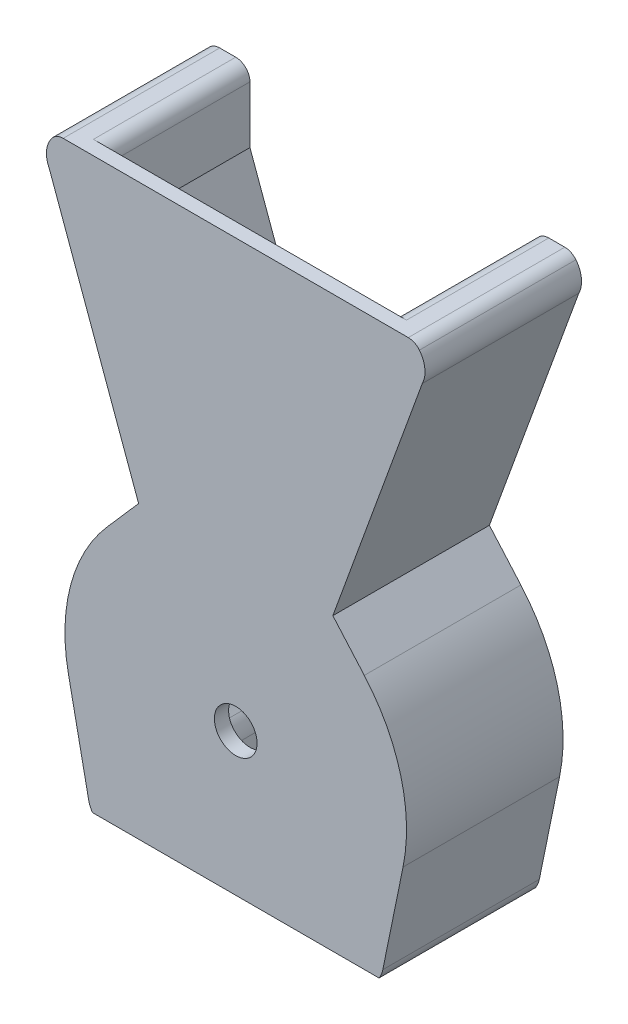
from build123d import *

# Parameters (mm, degrees)
BOSS_EXTRUDE1_DEPTH     = 50
BOSS_EXTRUDE1_2_DEPTH   = 50
BOSS_EXTRUDE2_DEPTH     = 10
CHAMFER1_SIZE           = 15
CHAMFER1_SIZE_2         = 20
SKETCH4_W               = 160
SKETCH4_H               = 200
BOSS_EXTRUDE3_DEPTH     = 5
FILLET1_R               = 10
SKETCH5_R               = 7.5
CUT_EXTRUDE1_DEPTH      = 5
CUT_EXTRUDE5_DEPTH      = 140.373598648
CUT_EXTRUDE5_DEPTH_BACK = 140.373598648
FILLET4_R               = 5
SKETCH12_R              = 2
CUT_EXTRUDE6_DEPTH      = 10


with BuildPart() as part:
    # Sketch2 → Boss-Extrude1 (new body)
    with BuildSketch(Plane.XY):
        with BuildLine():
            Line((-50, 75), (-22.70223243, 0))
            Line((-22.70223243, 0), (-37.64392369, -17.092022104))
            ThreePointArc((-37.64392369, -17.092022104), (-49.971924127, -51.675350432), (-35.355339059, -85.355339059))
            Line((-35.355339059, -85.355339059), (-35.355339059, -100))
            Line((-35.355339059, -100), (-80, -100))
            Line((-80, -100), (-80, 100))
            Line((-80, 100), (-50, 100))
            Line((-50, 100), (-50, 75))
        make_face()
    extrude(amount=-BOSS_EXTRUDE1_DEPTH)



with BuildPart() as body_2:
    # Sketch2 → Boss-Extrude1 2 (new body)
    with BuildSketch(Plane.XY):
        with BuildLine():
            Line((50, 75), (22.70223243, 0))
            Line((22.70223243, 0), (37.64392369, -17.092022104))
            ThreePointArc((37.64392369, -17.092022104), (49.971924127, -51.675350432), (35.355339059, -85.355339059))
            Line((35.355339059, -85.355339059), (35.355339059, -100))
            Line((35.355339059, -100), (80, -100))
            Line((80, -100), (80, 100))
            Line((80, 100), (50, 100))
            Line((50, 100), (50, 75))
        make_face()
    extrude(amount=-BOSS_EXTRUDE1_2_DEPTH)


with BuildPart() as part_1:
    add(part.part)

    add(body_2.part)  # Boss-Extrude2 merges body 2
    # Sketch3 → Boss-Extrude2 (add)
    with BuildSketch(Plane.XY):
        Polygon((-29.981637115, 20), (29.981637115, 20), (22.70223243, 0), (-22.70223243, 0), align=None)
    extrude(amount=-BOSS_EXTRUDE2_DEPTH)

    # Chamfer1
    # the kernel refuses this chamfer: 20, 15 mm, written as the material it takes off along each edge
    with BuildSketch(Plane(origin=(-81.595588718, 20, -10), x_dir=(0, 0.041308380137954244, 0.9991464445867674), z_dir=(1, 0, 0))) as chamfer1_piece_1_section:
        Polygon((CHAMFER1_SIZE * 0.999146444587, CHAMFER1_SIZE * 0.041308380138), (-CHAMFER1_SIZE_2 * 0.041308380138, CHAMFER1_SIZE_2 * 0.999146444587), (0, 0), align=None)
    chamfer1_piece_1 = extrude(amount=163.191177435, mode=Mode.PRIVATE)
    chamfer1_piece_1 = split(chamfer1_piece_1, bisect_by=Plane(origin=(-24.447399798, 4.794807938, -4.975922198), z_dir=(0.9396926207859094, 0.3420201433256661, 0)), keep=Keep.TOP, mode=Mode.PRIVATE)
    chamfer1_piece_1 = split(chamfer1_piece_1, bisect_by=Plane(origin=(24.447399798, 4.794807938, -4.975922198), z_dir=(-0.939692620785907, 0.34202014332567265, 0)), keep=Keep.TOP, mode=Mode.PRIVATE)
    add(chamfer1_piece_1, mode=Mode.SUBTRACT)

    # Sketch4 → Boss-Extrude3 (add)
    with BuildSketch(Plane.XY):
        Rectangle(SKETCH4_W, SKETCH4_H)
    extrude(amount=BOSS_EXTRUDE3_DEPTH)

    # Fillet1
    fillet1_edges = [part_1.edges().sort_by_distance(p)[0] for p in [
        (-22.70223243, 0, -30),
        (-35.355339059, -85.355339059, -25),
        (35.355339059, -85.355339059, -25),
        (22.70223243, 0, -30),
        (0, 13.333333333, 0),
    ]]
    fillet(fillet1_edges, radius=FILLET1_R)

    # Sketch5 → Cut-Extrude1 (cut)
    with BuildSketch(Plane(origin=(0, 0, 0), x_dir=(-1, 0, 0), z_dir=(0, 0, -1))):
        with Locations((0, -50)):
            Circle(SKETCH5_R)
    extrude(amount=-CUT_EXTRUDE1_DEPTH, mode=Mode.SUBTRACT)

    # Sketch11 → Cut-Extrude5 (cut, two sides: drawn at the far end of the back side and taken through both)
    with BuildSketch(Plane(origin=(0, 0, -50), x_dir=(-1, 0, 0), z_dir=(0, 0, -1)).offset(-CUT_EXTRUDE5_DEPTH_BACK)):
        with BuildLine():
            Line((-58.784198233, -62.017405631), (-51.672968794, -96.802610845))
            ThreePointArc((-51.672968794, -96.802610845), (-51.161121522, -98.466118532), (-50.338653833, -100))
            Line((-50.338653833, -100), (-80, -100))
            Line((-80, -100), (-80, 100))
            Line((-80, 100), (-62.474937186, 100))
            ThreePointArc((-62.474937186, 100), (-66.199502533, 94.806221081), (-65.536970349, 88.4494312))
            Line((-65.536970349, 88.4494312), (-60, 73.236730193))
            Line((-60, 73.236730193), (-34.120235365, 2.132661237))
            Line((-34.120235365, 2.132661237), (-45.172708428, -10.510426525))
            ThreePointArc((-45.172708428, -10.510426525), (-58.008635864, -34.670350128), (-58.784198233, -62.017405631))
        make_face()
        with BuildLine():
            Line((34.120235365, 2.132661237), (45.172708428, -10.510426525))
            ThreePointArc((45.172708428, -10.510426525), (58.008635864, -34.670350128), (58.784198233, -62.017405631))
            Line((58.784198233, -62.017405631), (51.672968794, -96.802610845))
            ThreePointArc((51.672968794, -96.802610845), (51.161121522, -98.466118532), (50.338653833, -100))
            Line((50.338653833, -100), (80, -100))
            Line((80, -100), (80, 100))
            Line((80, 100), (62.474937186, 100))
            ThreePointArc((62.474937186, 100), (66.199502533, 94.806221081), (65.536970349, 88.4494312))
            Line((65.536970349, 88.4494312), (60, 73.236730193))
            Line((60, 73.236730193), (34.120235365, 2.132661237))
        make_face()
    extrude(amount=CUT_EXTRUDE5_DEPTH + CUT_EXTRUDE5_DEPTH_BACK, mode=Mode.SUBTRACT)

    # Fillet4
    fillet4_edges = [part_1.edges().sort_by_distance(p)[0] for p in [
        (-35.355339059, -100, -25),
        (-50, 100, -25),
        (62.474937186, 100, -22.5),
        (-62.474937186, 100, -22.5),
        (50, 100, -25),
        (35.355339059, -100, -25),
    ]]
    fillet(fillet4_edges, radius=FILLET4_R)

    # Sketch12 → Cut-Extrude6 (cut)
    with BuildSketch(Plane(origin=(0, 0, -50), x_dir=(-1, 0, 0), z_dir=(0, 0, -1))):
        with Locations((-57.5, 92.5)):
            Circle(SKETCH12_R)
        with Locations((57.5, 92.5)):
            Circle(SKETCH12_R)
        with Locations((-42.855339059, -95)):
            Circle(SKETCH12_R)
        with Locations((42.855339059, -95)):
            Circle(SKETCH12_R)
    extrude(amount=-CUT_EXTRUDE6_DEPTH, mode=Mode.SUBTRACT)


solid = part_1.part
